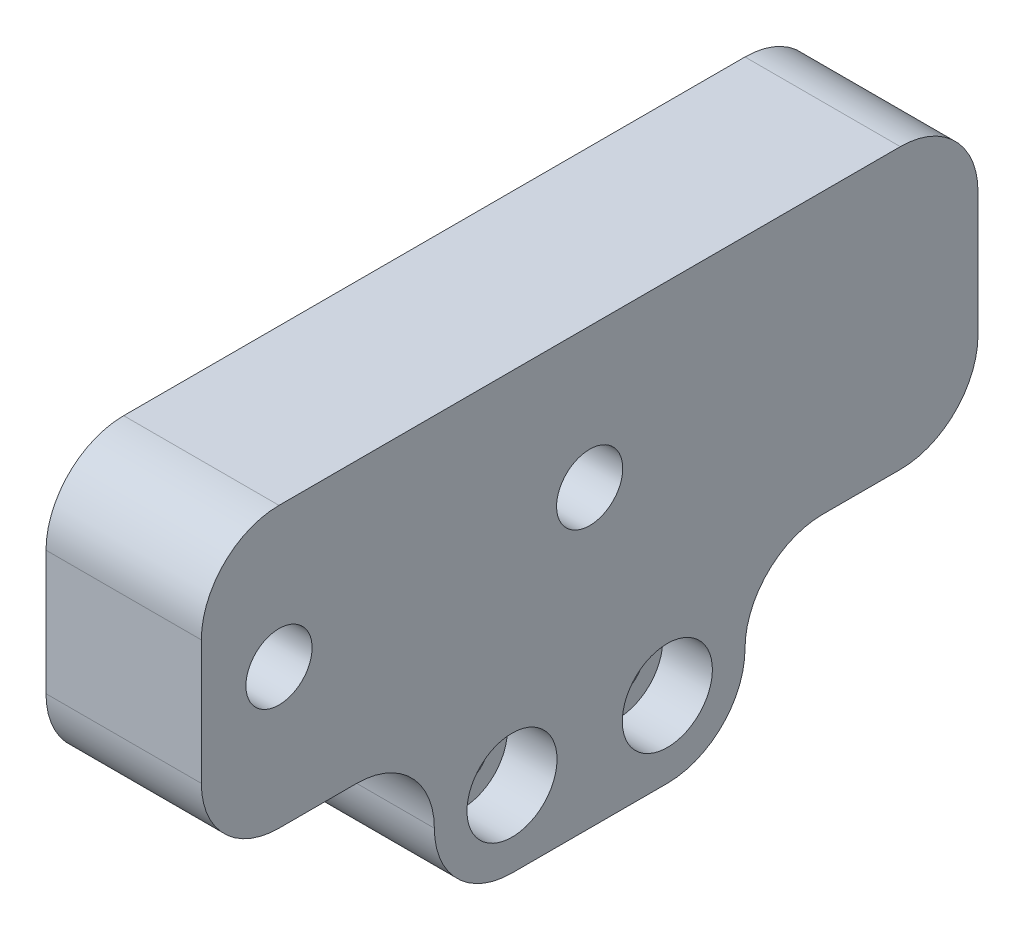
from build123d import *

# Parameters (mm, degrees)
PROFILE_W                = 12.7
PROFILE_H                = 22.86
PROFILE_W_2              = 6.35
PROFILE_H_2              = 12.7
BOSS_EXTRUDE1_DEPTH      = 12.7
SKETCH7_W                = 19.05
SKETCH7_H                = 12.7
BOSS_EXTRUDE2_DEPTH      = 25.4
CUT_EXTRUDE1_DEPTH       = 37.45585824
CUT_EXTRUDE1_DEPTH_BACK  = 37.45585824
SCREWHOLE_R              = 2.159
CUT_EXTRUDE2_START       = -4.064
SKETCH3_R                = 3.683
SKETCH3_R_2              = 2.159
CUT_EXTRUDE2_DEPTH       = 4.064
BOSS_EXTRUDE4_DEPTH      = 31.75
BOSS_EXTRUDE4_DEPTH_BACK = 31.75
SKETCH11_W               = 12.7
SKETCH11_H               = 22.86
SKETCH14_R               = 2.7051
CUT_EXTRUDE3_DEPTH       = 8.89
SKETCH13_R               = 1.143
CUT_EXTRUDE4_DEPTH       = 8.89
FILLET1_R                = 6.35


with BuildPart() as part:
    # Profile → Boss-Extrude1 (new, symmetric)
    with BuildSketch(Plane.XY):
        with Locations((0, 11.43)):
            Rectangle(PROFILE_W, PROFILE_H)
        with Locations((3.175, -6.35)):
            Rectangle(PROFILE_W_2, PROFILE_H_2)
    extrude(amount=BOSS_EXTRUDE1_DEPTH, both=True)

    # Sketch7 → Boss-Extrude2 (add)
    with BuildSketch(Plane.XY.offset(12.7)):
        with Locations((-9.525, -6.35)):
            Rectangle(SKETCH7_W, SKETCH7_H)
    extrude(amount=-BOSS_EXTRUDE2_DEPTH)

    # ScrewHole → Cut-Extrude1 (cut, two sides: drawn at the far end of the back side and taken through both)
    with BuildSketch(Plane.ZY.offset(19.05).offset(-CUT_EXTRUDE1_DEPTH_BACK)):
        with Locations(Location((6.35, -6.477, 0), (0, 0, 270))):
            Circle(SCREWHOLE_R)
        with Locations(Location((-6.35, -6.477, 0), (0, 0, 270))):
            Circle(SCREWHOLE_R)
    extrude(amount=CUT_EXTRUDE1_DEPTH + CUT_EXTRUDE1_DEPTH_BACK, mode=Mode.SUBTRACT)

    # Sketch3 → Cut-Extrude2 (cut)
    # profile 1 of 2: a face of its own
    with BuildSketch(Plane(origin=(6.35, 0, 0), x_dir=(0, 0, -1), z_dir=(1, 0, 0)).offset(CUT_EXTRUDE2_START)):
        with Locations(Location((-6.35, -6.477, 0), (0, 0, 90))):
            Circle(SKETCH3_R)
        with Locations(Location((-6.35, -6.477, 0), (0, 0, 270))):
            Circle(SKETCH3_R_2, mode=Mode.SUBTRACT)
    # profile 2 of 2: a face of its own
    with BuildSketch(Plane(origin=(6.35, 0, 0), x_dir=(0, 0, -1), z_dir=(1, 0, 0)).offset(CUT_EXTRUDE2_START)):
        with Locations(Location((6.35, -6.477, 0), (0, 0, 90))):
            Circle(SKETCH3_R)
    extrude(amount=CUT_EXTRUDE2_DEPTH, mode=Mode.SUBTRACT)

    # Sketch11 → Boss-Extrude4 (add, two sides: drawn at the far end of the back side and taken through both)
    with BuildSketch(Plane.XY.offset(-BOSS_EXTRUDE4_DEPTH_BACK)):
        with Locations((0, 11.43)):
            Rectangle(SKETCH11_W, SKETCH11_H)
    extrude(amount=BOSS_EXTRUDE4_DEPTH + BOSS_EXTRUDE4_DEPTH_BACK)

    # Sketch14 → Cut-Extrude3 (cut)
    with BuildSketch(Plane(origin=(6.35, 0, 0), x_dir=(0, 0, -1), z_dir=(1, 0, 0))):
        with Locations(Location((-25.4, 11.43, 0), (0, 0, 90))):
            Circle(SKETCH14_R)
        with Locations(Location((0, 11.43, 0), (0, 0, 90))):
            Circle(SKETCH14_R)
    extrude(amount=-CUT_EXTRUDE3_DEPTH, mode=Mode.SUBTRACT)

    # Sketch13 → Cut-Extrude4 (cut)
    with BuildSketch(Plane.ZY.offset(6.35)):
        with Locations(Location((-26.67, 17.78, 0), (0, 0, 270))):
            Circle(SKETCH13_R)
        with Locations(Location((-6.35, 17.78, 0), (0, 0, 270))):
            Circle(SKETCH13_R)
        with Locations(Location((-6.35, 5.08, 0), (0, 0, 270))):
            Circle(SKETCH13_R)
        with Locations(Location((-26.67, 5.08, 0), (0, 0, 270))):
            Circle(SKETCH13_R)
    extrude(amount=-CUT_EXTRUDE4_DEPTH, mode=Mode.SUBTRACT)

    # Fillet1
    fillet1_edges = [part.edges().sort_by_distance(p)[0] for p in [
        (-6.35, -12.7, -12.7),
        (-6.35, -12.7, 12.7),
        (0, 0, 31.75),
        (0, 22.86, 31.75),
        (0, 22.86, -31.75),
        (0, 0, -31.75),
        (0, 0, -12.7),
        (0, 0, 12.7),
    ]]
    fillet(fillet1_edges, radius=FILLET1_R - 0.0001)  # a hair under: the kernel refuses the full size


solid = part.part
